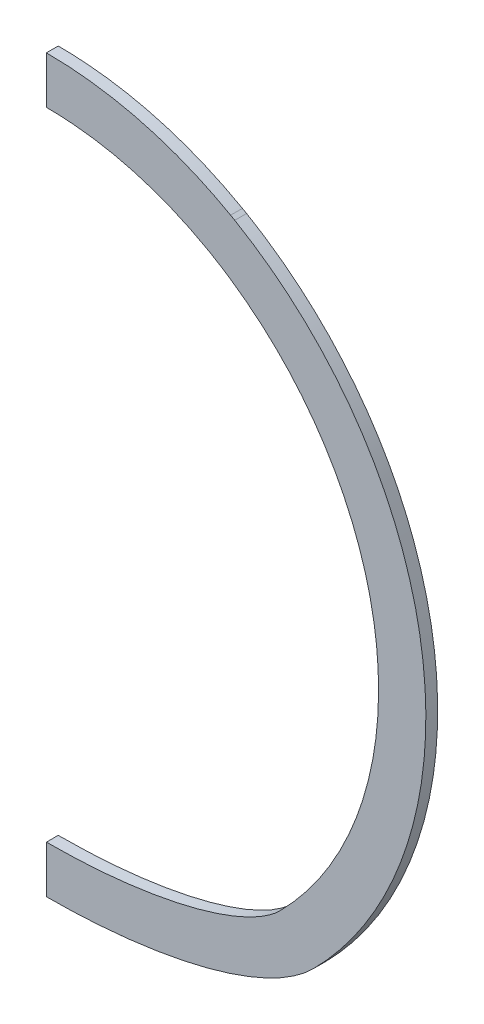
from build123d import *

# Parameters (mm, degrees)
BOSS_EXTRUDE1_DEPTH = 3.175
SKETCH3_W           = 129.389558459
SKETCH3_H           = 294.720660933
CUT_EXTRUDE1_DEPTH  = 146.946732918


with BuildPart() as part:
    # Sketch2 → Boss-Extrude1 (new body)
    with BuildSketch(Plane.XY):
        with BuildLine():
            add(Edge.make_bspline(
                [(-71.677392112, -72.91043434), (-72.109242456, -72.4766599), (-72.972872043, -71.593614958), (-74.469591152, -70.002616718), (-75.837182996, -68.488043391), (-77.186084408, -66.931897067), (-78.515677479, -65.334729876), (-79.824432739, -63.69624614), (-81.54760822, -61.446428575), (-83.64161213, -58.529673548), (-85.629566809, -55.501403393), (-87.162218254, -52.997335562), (-88.285911427, -51.070131488), (-90.114728738, -47.772436811), (-92.549922179, -42.891387424), (-95.3516338, -36.175158441), (-97.806777615, -28.854790192), (-99.416568113, -22.492651102), (-100.484378106, -16.973479224), (-101.217383692, -12.115821661), (-101.805900705, -6.108471449), (-102.055561509, 1.055644647), (-101.63758347, 11.916616183), (-99.581715265, 24.703392789), (-94.947787628, 39.477591596), (-88.656512854, 52.708120751), (-80.043367163, 65.554146484), (-69.871244821, 76.755385293), (-58.636991603, 85.914826096), (-47.202028885, 92.898966836), (-35.790499648, 98.052224226), (-24.000842482, 101.716725174), (-12.029496563, 103.894248368), (-3.656941748, 104.395312689), (0.99110515, 104.372307848), (2.644688984, 104.347784008), (5.295920706, 104.255895368), (8.944129249, 104.002381094), (12.923536456, 103.566176285), (16.897932891, 102.969160213), (20.860675893, 102.210568115), (24.80503533, 101.28991654), (28.724197829, 100.207008268), (32.611281662, 98.961940132), (36.459348765, 97.555109249), (39.942943882, 96.118550993), (42.44327487, 94.981609399), (43.99462248, 94.237634049), (44.922549304, 93.78091779), (45.846607961, 93.314294304), (46.766722746, 92.837849145), (47.682656642, 92.351383169), (48.561810847, 91.873519084), (49.188310006, 91.524412896), (49.500915025, 91.348034768)],
                knots=[0, 0, 0, 0, 0.006795371, 0.013653749, 0.020575359, 0.027560428, 0.034609183, 0.041721853, 0.048898669, 0.063445664, 0.078252032, 0.085753069, 0.093319659, 0.100952039, 0.124124286, 0.148784986, 0.174947707, 0.20262677, 0.215493637, 0.232144402, 0.252599943, 0.276885796, 0.305032091, 0.363115877, 0.408011314, 0.462235121, 0.511576331, 0.564908162, 0.615597651, 0.658548959, 0.700915758, 0.742691235, 0.783870362, 0.824449909, 0.827808956, 0.831171349, 0.841278604, 0.854801757, 0.868378359, 0.882008332, 0.895691582, 0.909427999, 0.923217451, 0.937059793, 0.95095486, 0.964902468, 0.975397534, 0.978902417, 0.982410558, 0.985921952, 0.989436598, 0.99295449, 0.996475625, 1, 1, 1, 1], degree=3))
            add(Edge.make_bspline(
                [(49.500915025, 91.348034768), (49.872005924, 91.138482333), (50.241810712, 90.926750039), (50.610303013, 90.712853821)],
                knots=[0, 0, 0, 0, 1, 1, 1, 1], degree=3))
            add(Edge.make_bspline(
                [(50.610303013, 90.712853821), (51.128442093, 90.411846037), (52.167202685, 89.796039228), (53.932536969, 88.703576387), (55.579762788, 87.638711627), (57.218137155, 86.533145805), (58.847026669, 85.387425363), (60.465187486, 84.201108463), (62.61485058, 82.559008476), (65.268683437, 80.403244909), (68.38020159, 77.661045558), (71.420405526, 74.753669295), (74.379227375, 71.68115848), (77.246352549, 68.444125522), (79.542797672, 65.619898893), (81.324264236, 63.280297585), (82.635173495, 61.479754257), (83.915139631, 59.639466174), (85.682600666, 56.976700672), (87.896856718, 53.369477174), (90.462597049, 48.676901727), (92.889220315, 43.626105667), (95.132677705, 38.215723181), (97.146538959, 32.44823322), (98.88212407, 26.330630408), (100.289240179, 19.875099059), (101.25863273, 13.473856941), (101.817336128, 7.24671143), (102.015185645, 1.305015561), (101.87858065, -4.624237286), (101.39263307, -10.734726225), (100.537146292, -16.867570025), (99.329398352, -22.86381348), (97.893600846, -28.372193875), (96.656960211, -32.269847721), (95.785564151, -34.744415114), (95.0459628, -36.764317914), (93.953188789, -39.535816997), (92.43580554, -43.007047711), (90.821696456, -46.36490671), (89.118620831, -49.608230444), (87.334164726, -52.736260206), (85.475724639, -55.748623833), (83.55049497, -58.64531039), (81.56545684, -61.42664709), (79.307705413, -64.380683017), (77.436977348, -66.647222523), (76.007346494, -68.288860963), (75.29509586, -69.089727056), (74.579038656, -69.87823774), (73.859443089, -70.654502436), (73.136338858, -71.418398838), (72.317504882, -72.264736672), (71.891235125, -72.69667798), (71.678426975, -72.91043429)],
                knots=[0, 0, 0, 0, 0.010157109, 0.020393378, 0.030708694, 0.04110294, 0.051575992, 0.062127721, 0.072757993, 0.094253595, 0.116061609, 0.138180754, 0.160609666, 0.183346893, 0.206390897, 0.218027437, 0.229740057, 0.241528542, 0.253392669, 0.280162256, 0.30828042, 0.337739229, 0.368530108, 0.400643849, 0.434070605, 0.468799897, 0.504820602, 0.536144777, 0.567394405, 0.598569553, 0.629670285, 0.664058743, 0.696204476, 0.726123241, 0.753829745, 0.760691378, 0.767515904, 0.787767528, 0.807687634, 0.827278023, 0.846540474, 0.865476741, 0.88408856, 0.902377642, 0.920345676, 0.937994331, 0.961031903, 0.966703489, 0.972340071, 0.97794171, 0.983508463, 0.989040391, 0.99453755, 1, 1, 1, 1], degree=3))
            add(Edge.make_bspline(
                [(71.678426975, -72.91043429), (46.359928794, -98.341734638), (-46.358893881, -98.341734638), (-71.677392112, -72.91043434)],
                knots=[0, 0, 0, 0, 1, 1, 1, 1], degree=3, weights=[1, 1, 1, 1]))
        make_face()
        with BuildLine():
            add(Edge.make_bspline(
                [(-62.677197057, -63.950161522), (-62.895509204, -63.730876692), (-63.321725733, -63.298342375), (-64.002059554, -62.592101669), (-64.753829554, -61.794622516), (-65.703931611, -60.764569773), (-66.804574903, -59.527416198), (-68.556788175, -57.468052236), (-70.648178443, -54.835505477), (-73.811350461, -50.469012961), (-77.394544541, -44.756057433), (-82.302878117, -35.13540616), (-86.810757895, -22.360038108), (-90.354277409, -0.967371821), (-87.649941962, 26.350088977), (-73.333390238, 55.972118358), (-49.623996274, 78.708841275), (-24.487235723, 89.383519301), (-3.090994932, 92.115890306), (13.038963103, 91.197514401), (26.120286031, 87.996586306), (34.879374941, 84.524845656), (39.102105625, 82.510352052), (41.214271269, 81.410816796), (42.347028641, 80.797644792), (42.959233617, 80.456937494), (43.258169219, 80.288282027)],
                knots=[0, 0, 0, 0, 0.003906217, 0.007812434, 0.01171865, 0.015624867, 0.023437301, 0.031249734, 0.046874602, 0.062499469, 0.093749203, 0.124998938, 0.187498407, 0.249997875, 0.374996813, 0.499995751, 0.624994688, 0.749993626, 0.812493095, 0.874992564, 0.937492033, 0.968741767, 0.984366634, 0.992179068, 0.996085285, 0.999991501, 0.999991501, 0.999991501, 0.999991501], degree=3))
            add(Edge.make_bspline(
                [(43.258169219, 80.288282027), (43.339663738, 80.24226006), (43.502520945, 80.149972739), (43.746371392, 80.01083423), (43.989796594, 79.870982545), (44.151786326, 79.777278604), (44.232713854, 79.73030574)],
                knots=[0.002022438, 0.002022438, 0.002022438, 0.002022438, 0.251013535, 0.500004632, 0.748995729, 0.997986827, 0.997986827, 0.997986827, 0.997986827], degree=3))
            add(Edge.make_bspline(
                [(44.232713854, 79.73030574), (44.58444416, 79.525959484), (45.259622085, 79.127643656), (46.415361761, 78.422292298), (47.573803007, 77.692810893), (49.007921659, 76.758403592), (50.804832808, 75.530634538), (53.607223777, 73.493209173), (57.003409969, 70.790302329), (64.764138566, 63.842060668), (74.853642347, 51.769295456), (84.311822541, 33.000711524), (89.302574517, 12.581832114), (89.594071681, -8.463887057), (85.167338267, -29.022546245), (78.471156755, -43.288686452), (72.737789819, -52.004533398), (70.145497848, -55.492337454), (67.954788222, -58.18874646), (66.537169113, -59.834423786), (65.376799992, -61.124092609), (64.636118066, -61.923784826), (64.04885936, -62.544039678), (63.540759488, -63.072130947), (63.065749199, -63.559376825), (62.8132246, -63.814567336), (62.678231924, -63.950161468)],
                knots=[1.4601e-05, 1.4601e-05, 1.4601e-05, 1.4601e-05, 0.007826987, 0.015639373, 0.023451759, 0.031264145, 0.046888916, 0.062513688, 0.093763232, 0.125012776, 0.250010951, 0.375009125, 0.5000073, 0.625005475, 0.75000365, 0.875001825, 0.906251369, 0.937500913, 0.953125684, 0.968750456, 0.976562842, 0.984375228, 0.988281421, 0.992187614, 0.996093807, 1, 1, 1, 1], degree=3))
            add(Edge.make_bspline(
                [(62.678231924, -63.950161468), (62.442110433, -64.187331736), (61.973465348, -64.632177633), (60.848308103, -65.594894105), (59.178943877, -66.825880953), (56.737455869, -68.325151322), (52.942333804, -70.28884928), (47.260951473, -72.599488515), (39.221466424, -74.977986937), (30.229046438, -76.880115217), (17.304785319, -78.721740765), (0.000517457, -79.658688067), (-17.303750406, -78.721740765), (-30.228011525, -76.880115217), (-39.22043151, -74.977986937), (-47.25991656, -72.599488515), (-52.941298891, -70.28884928), (-56.736420955, -68.325151322), (-59.177908963, -66.825880953), (-60.84727319, -65.594894105), (-61.972430435, -64.632177633), (-62.441075519, -64.187331736), (-62.677197057, -63.950161522)],
                knots=[0, 0, 0, 0, 0.015625, 0.03125, 0.0625, 0.09375, 0.125, 0.1875, 0.25, 0.3125, 0.375, 0.5, 0.625, 0.6875, 0.75, 0.8125, 0.875, 0.90625, 0.9375, 0.96875, 0.984375, 1, 1, 1, 1], degree=3))
        make_face(mode=Mode.SUBTRACT)
    extrude(amount=-BOSS_EXTRUDE1_DEPTH)

    # Sketch3 → Cut-Extrude1 (cut, through all)
    with BuildSketch(Plane(origin=(0, 0, 0), x_dir=(0, 0, -1), z_dir=(1, 0, 0))):
        with Locations((3.684090068, 10.698040846)):
            Rectangle(SKETCH3_W, SKETCH3_H)
    extrude(amount=-CUT_EXTRUDE1_DEPTH, mode=Mode.SUBTRACT)


solid = part.part
